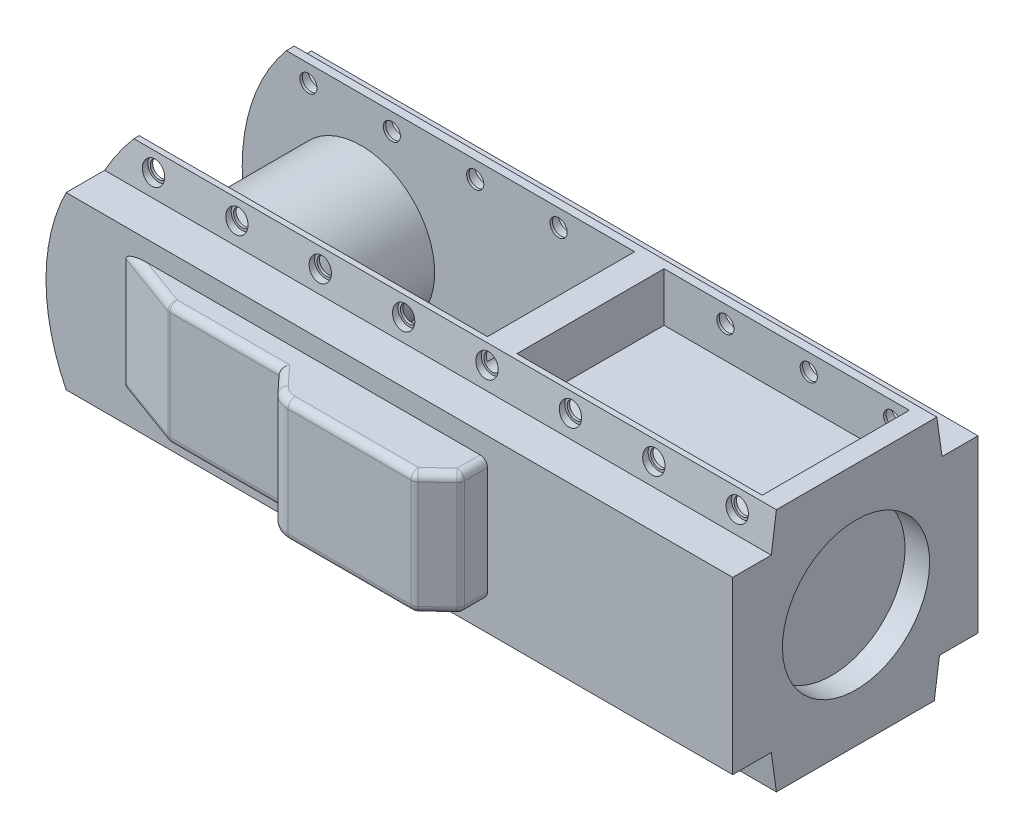
from build123d import *

# Parameters (mm, degrees)
BOSS_EXTRUDE1_DEPTH      = 50
CUT_EXTRUDE1_DEPTH       = 244.0672613377967
SKETCH4_W                = 284.0000000000001
SKETCH4_H                = 60.00000000000001
CUT_EXTRUDE2_DEPTH       = 201.298739878774
SKETCH6_W                = 15.000000000000007
SKETCH6_H                = 15
SKETCH6_W_2              = 13.951744254660802
CUT_EXTRUDE3_DEPTH       = 320.83626001686685
SKETCH7_R                = 29.999999999999996
BOSS_EXTRUDE2_DEPTH      = 30
BOSS_EXTRUDE3_DEPTH      = 10
BOSS_EXTRUDE4_DEPTH      = 20
CHAMFER1_SIZE            = 10
CHAMFER1_SIZE_2          = 9.325150861
CHAMFER2_SIZE            = 10.919107028
CHAMFER2_SIZE_2          = 30
FILLET1_R                = 3
CUT_EXTRUDE4_DEPTH       = 20
FILLET2_R                = 10
CHAMFER3_SIZE            = 20
CHAMFER3_SIZE_2          = 2.810816694
SKETCH11_R               = 3.5000000000000075
CUT_EXTRUDE5_DEPTH       = 30
SKETCH12_R               = 4.500000000000005
CUT_EXTRUDE6_DEPTH       = 19
LPATTERN1_COUNT          = 8
LPATTERN1_PITCH          = 34
MIRROR1_COPY_1_SKETCH_R  = 3.5000000000000075
MIRROR1_COPY_1_DEPTH     = 30
MIRROR1_COPY_2_SKETCH_R  = 3.5000000000000075
MIRROR1_COPY_2_DEPTH     = 30
MIRROR1_COPY_3_SKETCH_R  = 3.5000000000000075
MIRROR1_COPY_3_DEPTH     = 30
MIRROR1_COPY_4_SKETCH_R  = 3.5000000000000075
MIRROR1_COPY_4_DEPTH     = 30
MIRROR1_COPY_5_SKETCH_R  = 3.5000000000000075
MIRROR1_COPY_5_DEPTH     = 30
MIRROR1_COPY_6_SKETCH_R  = 3.5000000000000075
MIRROR1_COPY_6_DEPTH     = 30
MIRROR1_COPY_7_SKETCH_R  = 3.5000000000000075
MIRROR1_COPY_7_DEPTH     = 30
MIRROR1_COPY_8_SKETCH_R  = 4.500000000000005
MIRROR1_COPY_8_DEPTH     = 19
MIRROR1_COPY_9_SKETCH_R  = 4.500000000000005
MIRROR1_COPY_9_DEPTH     = 19
MIRROR1_COPY_10_SKETCH_R = 4.500000000000005
MIRROR1_COPY_10_DEPTH    = 19
MIRROR1_COPY_11_SKETCH_R = 4.500000000000005
MIRROR1_COPY_11_DEPTH    = 19
MIRROR1_COPY_12_SKETCH_R = 4.500000000000005
MIRROR1_COPY_12_DEPTH    = 19
MIRROR1_COPY_13_SKETCH_R = 4.500000000000005
MIRROR1_COPY_13_DEPTH    = 19
MIRROR1_COPY_14_SKETCH_R = 4.500000000000005
MIRROR1_COPY_14_DEPTH    = 19
MIRROR8_COPY_1_SKETCH_R  = 3.5000000000000075
MIRROR8_COPY_1_DEPTH     = 30
MIRROR8_COPY_2_SKETCH_R  = 3.5000000000000075
MIRROR8_COPY_2_DEPTH     = 30
MIRROR8_COPY_3_SKETCH_R  = 3.5000000000000075
MIRROR8_COPY_3_DEPTH     = 30
MIRROR8_COPY_4_SKETCH_R  = 3.5000000000000075
MIRROR8_COPY_4_DEPTH     = 30
MIRROR8_COPY_5_SKETCH_R  = 3.5000000000000075
MIRROR8_COPY_5_DEPTH     = 30
MIRROR8_COPY_6_SKETCH_R  = 3.5000000000000075
MIRROR8_COPY_6_DEPTH     = 30
MIRROR8_COPY_7_SKETCH_R  = 3.5000000000000075
MIRROR8_COPY_7_DEPTH     = 30
MIRROR8_COPY_8_SKETCH_R  = 4.500000000000005
MIRROR8_COPY_8_DEPTH     = 19
MIRROR8_COPY_9_SKETCH_R  = 4.500000000000005
MIRROR8_COPY_9_DEPTH     = 19
MIRROR8_COPY_10_SKETCH_R = 4.500000000000005
MIRROR8_COPY_10_DEPTH    = 19
MIRROR8_COPY_11_SKETCH_R = 4.500000000000005
MIRROR8_COPY_11_DEPTH    = 19
MIRROR8_COPY_12_SKETCH_R = 4.500000000000005
MIRROR8_COPY_12_DEPTH    = 19
MIRROR8_COPY_13_SKETCH_R = 4.500000000000005
MIRROR8_COPY_13_DEPTH    = 19
MIRROR8_COPY_14_SKETCH_R = 4.500000000000005
MIRROR8_COPY_14_DEPTH    = 19
MIRROR8_COPY_15_SKETCH_R = 3.5000000000000075
MIRROR8_COPY_15_DEPTH    = 30
MIRROR8_COPY_16_SKETCH_R = 4.500000000000005
MIRROR8_COPY_16_DEPTH    = 19
MIRROR8_COPY_17_SKETCH_R = 3.5000000000000075
MIRROR8_COPY_17_DEPTH    = 30
MIRROR8_COPY_18_SKETCH_R = 3.5000000000000075
MIRROR8_COPY_18_DEPTH    = 30
MIRROR8_COPY_19_SKETCH_R = 3.5000000000000075
MIRROR8_COPY_19_DEPTH    = 30
MIRROR8_COPY_20_SKETCH_R = 3.5000000000000075
MIRROR8_COPY_20_DEPTH    = 30
MIRROR8_COPY_21_SKETCH_R = 3.5000000000000075
MIRROR8_COPY_21_DEPTH    = 30
MIRROR8_COPY_22_SKETCH_R = 3.5000000000000075
MIRROR8_COPY_22_DEPTH    = 30
MIRROR8_COPY_23_SKETCH_R = 3.5000000000000075
MIRROR8_COPY_23_DEPTH    = 30
MIRROR8_COPY_24_SKETCH_R = 4.500000000000005
MIRROR8_COPY_24_DEPTH    = 19
MIRROR8_COPY_25_SKETCH_R = 4.500000000000005
MIRROR8_COPY_25_DEPTH    = 19
MIRROR8_COPY_26_SKETCH_R = 4.500000000000005
MIRROR8_COPY_26_DEPTH    = 19
MIRROR8_COPY_27_SKETCH_R = 4.500000000000005
MIRROR8_COPY_27_DEPTH    = 19
MIRROR8_COPY_28_SKETCH_R = 4.500000000000005
MIRROR8_COPY_28_DEPTH    = 19
MIRROR8_COPY_29_SKETCH_R = 4.500000000000005
MIRROR8_COPY_29_DEPTH    = 19
MIRROR8_COPY_30_SKETCH_R = 4.500000000000005
MIRROR8_COPY_30_DEPTH    = 19
SKETCH13_R               = 30
CUT_EXTRUDE7_DEPTH       = 10


with BuildPart() as part:
    # Sketch2 → Boss-Extrude1 (new, symmetric)
    with BuildSketch(Plane.XY):
        Polygon((113.60751124921575, 146.27109496266473), (-166.39248875078428, 146.2710949626647), (-166.39248875078428, 46.60603145320362), (113.60751124921576, 46.60603145320365), align=None)
    extrude(amount=BOSS_EXTRUDE1_DEPTH, both=True)

    # Sketch3 → Cut-Extrude1 (cut, through all)
    with BuildSketch(Plane.XY.offset(50)):
        with BuildLine():
            ThreePointArc((-166.39248875078425, 96.4385632079337), (-161.75456677804212, 122.93045451964585), (-148.3924887507843, 146.2710949626647))
            Line((-148.3924887507843, 146.2710949626647), (-166.39248875078428, 146.2710949626647))
            Line((-166.39248875078428, 146.2710949626647), (-166.39248875078428, 96.4385632079337))
        make_face()
        with BuildLine():
            ThreePointArc((-148.3924887507843, 46.60603145320361), (-161.75456677804198, 69.94667189622204), (-166.39248875078425, 96.4385632079337))
            Line((-166.39248875078428, 96.4385632079337), (-166.39248875078428, 46.60603145320363))
            Line((-166.39248875078428, 46.60603145320362), (-148.3924887507843, 46.60603145320362))
        make_face()
    extrude(amount=-CUT_EXTRUDE1_DEPTH, mode=Mode.SUBTRACT)

    # Sketch4 → Cut-Extrude2 (cut, through all)
    with BuildSketch(Plane(origin=(-1.45e-14, 146.27109496266473, 0), x_dir=(1, 1.3e-16, 0), z_dir=(-1.3e-16, 1, 0))):
        with Locations((-148.3924887507843, 0)):
            Rectangle(SKETCH4_W, SKETCH4_H)
    extrude(amount=-CUT_EXTRUDE2_DEPTH, mode=Mode.SUBTRACT)

    # Sketch6 → Cut-Extrude3 (cut, through all)
    with BuildSketch(Plane(origin=(113.60751124921576, 1.582e-14, 0), x_dir=(0, 0, -1), z_dir=(1, 1.4e-16, 0))):
        with Locations((-42.5, 138.7710949626647)):
            Rectangle(SKETCH6_W, SKETCH6_H)
        with Locations((43.02412787266961, 138.7710949626647)):
            Rectangle(SKETCH6_W_2, SKETCH6_H)
        with Locations((-42.5, 54.106031453203634)):
            Rectangle(SKETCH6_W, SKETCH6_H)
        with Locations((42.5, 54.106031453203634)):
            Rectangle(SKETCH6_W, SKETCH6_H)
    extrude(amount=-CUT_EXTRUDE3_DEPTH, mode=Mode.SUBTRACT)

    # Sketch7 → Boss-Extrude2 (add, symmetric)
    with BuildSketch(Plane.XY):
        with Locations(Location((-117.91264654563462, 98.03009001292648, 0), (0, 0, 180))):
            Circle(SKETCH7_R)
    extrude(amount=BOSS_EXTRUDE2_DEPTH, both=True)

    # Sketch8 → Boss-Extrude3 (add)
    with BuildSketch(Plane.XY.offset(50)):
        Polygon((-61.39248875078425, 123.0300900129265), (-136.39248875078422, 123.0300900129265), (-136.39248875078425, 73.03009001292648), (-61.39248875078425, 73.03009001292648), align=None)
        Polygon((13.607511249215747, 123.0300900129265), (-61.39248875078425, 123.0300900129265), (-61.39248875078425, 73.03009001292648), (13.607511249215747, 73.0300900129265), align=None)
    extrude(amount=BOSS_EXTRUDE3_DEPTH)

    # Sketch8<3> → Boss-Extrude4 (add)
    with BuildSketch(Plane.XY.offset(50)):
        Polygon((13.607511249215747, 123.0300900129265), (-61.39248875078425, 123.0300900129265), (-61.39248875078425, 73.03009001292648), (13.607511249215747, 73.0300900129265), align=None)
    extrude(amount=BOSS_EXTRUDE4_DEPTH)

    # Chamfer1
    # the kernel refuses this chamfer: 10, 9.325150861 mm, written as the material it takes off along each edge
    with BuildSketch(Plane(origin=(13.607511249215754, 47.289699862795544, 70), x_dir=(-0.9996489389454055, 0, 0.026495261186203833), z_dir=(-1.1e-16, 1, 0))) as chamfer1_piece_1:
        Polygon((CHAMFER1_SIZE * 0.999648938945, -CHAMFER1_SIZE * 0.0264952611862), (-CHAMFER1_SIZE_2 * 0.0264952611873, -CHAMFER1_SIZE_2 * 0.999648938986), (0, 0), align=None)
    extrude(amount=101.4807803002619, mode=Mode.SUBTRACT)
    with BuildSketch(Plane(origin=(-61.39248875078425, 148.77048016305744, 70), x_dir=(-0.026495261186203822, 0, -0.9996489389454055), z_dir=(0, -1, 0))) as chamfer1_piece_2:
        Polygon((CHAMFER1_SIZE * 0.999648938945, CHAMFER1_SIZE * 0.0264952611862), (-CHAMFER1_SIZE_2 * 0.0264952611873, CHAMFER1_SIZE_2 * 0.999648938986), (0, 0), align=None)
    extrude(amount=101.48078030026191, mode=Mode.SUBTRACT)

    # Chamfer2
    # the kernel refuses this chamfer: 30, 10.919107028 mm, written as the material it takes off along each edge
    with BuildSketch(Plane(origin=(-136.39248875078417, 200.85593198944264, 60), x_dir=(-0.09904090225204853, 0, -0.9950833631817488), z_dir=(-5.7e-16, -1, 0))) as chamfer2_piece_1_section:
        Polygon((CHAMFER2_SIZE * 0.99508336318, CHAMFER2_SIZE * 0.0990409022519), (-CHAMFER2_SIZE_2 * 0.099040902252, CHAMFER2_SIZE_2 * 0.995083363182), (0, 0), align=None)
    chamfer2_piece_1 = extrude(amount=205.65168395303226, mode=Mode.PRIVATE)
    chamfer2_piece_1 = split(chamfer2_piece_1, bisect_by=Plane(origin=(-125.96440191049959, 98.03009001292652, 50), z_dir=(0, 0, 1)), keep=Keep.TOP, mode=Mode.PRIVATE)
    add(chamfer2_piece_1, mode=Mode.SUBTRACT)

    # Fillet1
    fillet1_edges = [part.edges().sort_by_distance(p)[0] for p in [
        (13.607511249215747, 123.0300900129265, 55.337424569310656),
        (13.60751124921575, 73.0300900129265, 55.337424569310656),
        (13.607511249217987, 98.0300900129265, 60.67484913862131),
        (-24.229913320092628, 73.03009001292648, 70),
        (-56.72991332009458, 73.03009001292648, 65.00000000000203),
        (8.6075112492179, 73.03009001292648, 65.3374245693107),
        (-24.229913320092628, 123.0300900129265, 70),
        (3.607511249220053, 98.0300900129265, 69.999999999998),
        (-56.72991332009458, 123.0300900129265, 65.00000000000202),
        (8.6075112492179, 123.0300900129265, 65.3374245693107),
        (-83.89248875078044, 73.03009001292648, 60),
        (-83.89248875078044, 123.0300900129265, 60),
        (-106.39248875077664, 98.03009001292648, 60),
        (-120.12987584805919, 73.03009001292646, 55),
        (-120.12987584805919, 123.03009001292648, 55),
    ]]
    fillet(fillet1_edges, radius=FILLET1_R)

    # Sketch10 → Cut-Extrude4 (cut)
    with BuildSketch(Plane(origin=(-1.45e-14, 146.27109496266473, 0), x_dir=(1, 1e-16, 0), z_dir=(-1e-16, 1, 0))):
        Polygon((5.607511249215772, 30.000000000000004), (105.60751124921578, 30.000000000000004), (105.60751124921579, -29.999999999999996), (5.607511249215779, -30), align=None)
    extrude(amount=-CUT_EXTRUDE4_DEPTH, mode=Mode.SUBTRACT)

    # Fillet2
    # the kernel refuses this fillet: 10 mm, written as the material it takes off along each edge
    with BuildSketch(Plane(origin=(-47.719214139796605, 123.0300900129265, 60), x_dir=(-0.7313537016190976, 0, 0.6819983600625766), z_dir=(-0.6819983600625766, 0, -0.7313537016190976))) as fillet2_piece_1:
        with BuildLine():
            CenterArc((7, -3), 3, 0, 90)
            Line((10, -3), (10, 0))
            Line((10, 0), (7, 0))
        make_face()
    revolve(axis=Axis((-47.719214139796605, 123.0300900129265, 60), (0, 1, 0)), revolution_arc=46.99999999999388, mode=Mode.SUBTRACT)
    with BuildSketch(Plane(origin=(-47.719214139796605, 73.03009001292648, 60), x_dir=(0, 0, 1), z_dir=(1, 0, 0))) as fillet2_piece_2:
        with BuildLine():
            CenterArc((7, -3), 3, 0, 90)
            Line((10, -3), (10, 0))
            Line((10, 0), (7, 0))
        make_face()
    revolve(axis=Axis((-47.719214139796605, 73.03009001292648, 60), (0, -1, 0)), revolution_arc=46.99999999999388, mode=Mode.SUBTRACT)
    with BuildSketch(Plane(origin=(-52.06733788940717, 123.03009001292651, 70), x_dir=(1, 0, 0), z_dir=(0, -1, 0))) as fillet2_piece_3:
        with BuildLine():
            CenterArc((FILLET2_R * 0.434812374961, -FILLET2_R), FILLET2_R, 90, 46.99999999999392)
            Line((-FILLET2_R * 0.296541326658, -FILLET2_R * 0.318001639937), (0, 0))
            Line((0, 0), (FILLET2_R * 0.434812374961, 0))
        make_face()
    extrude(amount=50.000000000000014, mode=Mode.SUBTRACT)

    # Chamfer3
    # the kernel refuses this chamfer: 20, 2.810816694 mm, written as the material it takes off along each edge
    with BuildSketch(Plane(origin=(165.58879262769187, 146.27109496266473, 35), x_dir=(0, -0.9999856632816031, 0.005354739139527851), z_dir=(-1, -1.4e-16, 0))) as chamfer3_piece_1_section:
        Polygon((CHAMFER3_SIZE * 0.999985663282, -CHAMFER3_SIZE * 0.00535473913953), (-CHAMFER3_SIZE_2 * 0.00535473913962, -CHAMFER3_SIZE_2 * 0.999985663299), (0, 0), align=None)
    chamfer3_piece_1 = extrude(amount=365.9625627569523, mode=Mode.PRIVATE)
    chamfer3_piece_1 = split(chamfer3_piece_1, bisect_by=Plane(origin=(-17.39248875078428, 131.2710949626647, 34.19252177355839), z_dir=(-1.4e-16, 1, 0)), keep=Keep.TOP, mode=Mode.PRIVATE)
    add(chamfer3_piece_1, mode=Mode.SUBTRACT)
    with BuildSketch(Plane(origin=(165.58879262769193, 46.606031453203656, 35), x_dir=(0, 0.9999856632816031, 0.005354739139527851), z_dir=(-1, -1.4e-16, 0))) as chamfer3_piece_2_section:
        Polygon((CHAMFER3_SIZE * 0.999985663282, CHAMFER3_SIZE * 0.00535473913953), (-CHAMFER3_SIZE_2 * 0.00535473913962, CHAMFER3_SIZE_2 * 0.999985663299), (0, 0), align=None)
    chamfer3_piece_2 = extrude(amount=365.9625627569524, mode=Mode.PRIVATE)
    chamfer3_piece_2 = split(chamfer3_piece_2, bisect_by=Plane(origin=(-17.392488750784253, 61.60603145320363, 34.19252177355842), z_dir=(1.4e-16, -1, 0)), keep=Keep.TOP, mode=Mode.PRIVATE)
    add(chamfer3_piece_2, mode=Mode.SUBTRACT)
    with BuildSketch(Plane(origin=(165.58879262769193, 46.606031453203656, -35), x_dir=(0, 0.9999856632816031, -0.005354739139527851), z_dir=(-1, -1.4e-16, 0))) as chamfer3_piece_3_section:
        Polygon((CHAMFER3_SIZE * 0.999985663282, -CHAMFER3_SIZE * 0.00535473913953), (-CHAMFER3_SIZE_2 * 0.00535473913962, -CHAMFER3_SIZE_2 * 0.999985663299), (0, 0), align=None)
    chamfer3_piece_3 = extrude(amount=365.9625627569524, mode=Mode.PRIVATE)
    chamfer3_piece_3 = split(chamfer3_piece_3, bisect_by=Plane(origin=(-17.39248875078431, 61.60603145320363, -34.19252177355841), z_dir=(1.4e-16, -1, 0)), keep=Keep.TOP, mode=Mode.PRIVATE)
    add(chamfer3_piece_3, mode=Mode.SUBTRACT)
    with BuildSketch(Plane(origin=(165.58879262769187, 146.27109496266473, -36.048255745339205), x_dir=(0, 0.261660851194172, 0.9651598825854406), z_dir=(-1, -1.4e-16, 0))) as chamfer3_piece_4_section:
        Polygon((CHAMFER3_SIZE_2 * 0.965159882602, -CHAMFER3_SIZE_2 * 0.261660851199), (-CHAMFER3_SIZE * 0.261660851194, -CHAMFER3_SIZE * 0.965159882585), (0, 0), align=None)
    chamfer3_piece_4 = extrude(amount=365.9625627569523, mode=Mode.PRIVATE)
    chamfer3_piece_4 = split(chamfer3_piece_4, bisect_by=Plane(origin=(-17.392488750784253, 131.2710949626647, -35.240777518897666), z_dir=(-1.4e-16, 1, 0)), keep=Keep.TOP, mode=Mode.PRIVATE)
    add(chamfer3_piece_4, mode=Mode.SUBTRACT)

    # Sketch11 → Cut-Extrude5 (cut)
    with BuildSketch(Plane.XY.offset(50)):
        with Locations((98.60751124921575, 139.2710949626647)):
            Circle(SKETCH11_R)
    cut_extrude5 = extrude(amount=-CUT_EXTRUDE5_DEPTH, mode=Mode.SUBTRACT)

    # Sketch12 → Cut-Extrude6 (cut)
    with BuildSketch(Plane.XY.offset(50)):
        with Locations((98.60751124921575, 139.2710949626647)):
            Circle(SKETCH12_R)
    cut_extrude6 = extrude(amount=-CUT_EXTRUDE6_DEPTH, mode=Mode.SUBTRACT)

    # LPattern1: Cut-Extrude5, Cut-Extrude6 ×8
    with Locations(*[(-i * LPATTERN1_PITCH, 0, 0) for i in range(1, LPATTERN1_COUNT)]):
        add(cut_extrude5, mode=Mode.SUBTRACT)
        add(cut_extrude6, mode=Mode.SUBTRACT)

    # Mirror1: Cut-Extrude5, Cut-Extrude6 across plane
    add(cut_extrude5.mirror(Plane.ZX.offset(96.43856320793418)), mode=Mode.SUBTRACT)
    add(cut_extrude6.mirror(Plane.ZX.offset(96.43856320793418)), mode=Mode.SUBTRACT)

    # Mirror1 copy 1 sketch → Mirror1 copy 1 (cut)
    with BuildSketch(Plane(origin=(-34.00000000000003, 192.87712641586836, 50), x_dir=(1, 2.8e-16, 0), z_dir=(0, 0, 1))):
        with Locations((98.60751124921575, -139.2710949626647)):
            Circle(MIRROR1_COPY_1_SKETCH_R)
    extrude(amount=-MIRROR1_COPY_1_DEPTH, mode=Mode.SUBTRACT)

    # Mirror1 copy 2 sketch → Mirror1 copy 2 (cut)
    with BuildSketch(Plane(origin=(-68.00000000000003, 192.87712641586833, 50), x_dir=(1, 2.8e-16, 0), z_dir=(0, 0, 1))):
        with Locations((98.60751124921575, -139.2710949626647)):
            Circle(MIRROR1_COPY_2_SKETCH_R)
    extrude(amount=-MIRROR1_COPY_2_DEPTH, mode=Mode.SUBTRACT)

    # Mirror1 copy 3 sketch → Mirror1 copy 3 (cut)
    with BuildSketch(Plane(origin=(-102.00000000000003, 192.87712641586833, 50), x_dir=(1, 2.8e-16, 0), z_dir=(0, 0, 1))):
        with Locations((98.60751124921575, -139.2710949626647)):
            Circle(MIRROR1_COPY_3_SKETCH_R)
    extrude(amount=-MIRROR1_COPY_3_DEPTH, mode=Mode.SUBTRACT)

    # Mirror1 copy 4 sketch → Mirror1 copy 4 (cut)
    with BuildSketch(Plane(origin=(-136.00000000000003, 192.87712641586833, 50), x_dir=(1, 2.8e-16, 0), z_dir=(0, 0, 1))):
        with Locations((98.60751124921575, -139.2710949626647)):
            Circle(MIRROR1_COPY_4_SKETCH_R)
    extrude(amount=-MIRROR1_COPY_4_DEPTH, mode=Mode.SUBTRACT)

    # Mirror1 copy 5 sketch → Mirror1 copy 5 (cut)
    with BuildSketch(Plane(origin=(-170.00000000000003, 192.8771264158683, 50), x_dir=(1, 2.8e-16, 0), z_dir=(0, 0, 1))):
        with Locations((98.60751124921575, -139.2710949626647)):
            Circle(MIRROR1_COPY_5_SKETCH_R)
    extrude(amount=-MIRROR1_COPY_5_DEPTH, mode=Mode.SUBTRACT)

    # Mirror1 copy 6 sketch → Mirror1 copy 6 (cut)
    with BuildSketch(Plane(origin=(-204.00000000000003, 192.8771264158683, 50), x_dir=(1, 2.8e-16, 0), z_dir=(0, 0, 1))):
        with Locations((98.60751124921575, -139.2710949626647)):
            Circle(MIRROR1_COPY_6_SKETCH_R)
    extrude(amount=-MIRROR1_COPY_6_DEPTH, mode=Mode.SUBTRACT)

    # Mirror1 copy 7 sketch → Mirror1 copy 7 (cut)
    with BuildSketch(Plane(origin=(-238.00000000000003, 192.8771264158683, 50), x_dir=(1, 2.8e-16, 0), z_dir=(0, 0, 1))):
        with Locations((98.60751124921575, -139.2710949626647)):
            Circle(MIRROR1_COPY_7_SKETCH_R)
    extrude(amount=-MIRROR1_COPY_7_DEPTH, mode=Mode.SUBTRACT)

    # Mirror1 copy 8 sketch → Mirror1 copy 8 (cut)
    with BuildSketch(Plane(origin=(-34.00000000000003, 192.87712641586836, 50), x_dir=(1, 2.8e-16, 0), z_dir=(0, 0, 1))):
        with Locations((98.60751124921575, -139.2710949626647)):
            Circle(MIRROR1_COPY_8_SKETCH_R)
    extrude(amount=-MIRROR1_COPY_8_DEPTH, mode=Mode.SUBTRACT)

    # Mirror1 copy 9 sketch → Mirror1 copy 9 (cut)
    with BuildSketch(Plane(origin=(-68.00000000000003, 192.87712641586833, 50), x_dir=(1, 2.8e-16, 0), z_dir=(0, 0, 1))):
        with Locations((98.60751124921575, -139.2710949626647)):
            Circle(MIRROR1_COPY_9_SKETCH_R)
    extrude(amount=-MIRROR1_COPY_9_DEPTH, mode=Mode.SUBTRACT)

    # Mirror1 copy 10 sketch → Mirror1 copy 10 (cut)
    with BuildSketch(Plane(origin=(-102.00000000000003, 192.87712641586833, 50), x_dir=(1, 2.8e-16, 0), z_dir=(0, 0, 1))):
        with Locations((98.60751124921575, -139.2710949626647)):
            Circle(MIRROR1_COPY_10_SKETCH_R)
    extrude(amount=-MIRROR1_COPY_10_DEPTH, mode=Mode.SUBTRACT)

    # Mirror1 copy 11 sketch → Mirror1 copy 11 (cut)
    with BuildSketch(Plane(origin=(-136.00000000000003, 192.87712641586833, 50), x_dir=(1, 2.8e-16, 0), z_dir=(0, 0, 1))):
        with Locations((98.60751124921575, -139.2710949626647)):
            Circle(MIRROR1_COPY_11_SKETCH_R)
    extrude(amount=-MIRROR1_COPY_11_DEPTH, mode=Mode.SUBTRACT)

    # Mirror1 copy 12 sketch → Mirror1 copy 12 (cut)
    with BuildSketch(Plane(origin=(-170.00000000000003, 192.8771264158683, 50), x_dir=(1, 2.8e-16, 0), z_dir=(0, 0, 1))):
        with Locations((98.60751124921575, -139.2710949626647)):
            Circle(MIRROR1_COPY_12_SKETCH_R)
    extrude(amount=-MIRROR1_COPY_12_DEPTH, mode=Mode.SUBTRACT)

    # Mirror1 copy 13 sketch → Mirror1 copy 13 (cut)
    with BuildSketch(Plane(origin=(-204.00000000000003, 192.8771264158683, 50), x_dir=(1, 2.8e-16, 0), z_dir=(0, 0, 1))):
        with Locations((98.60751124921575, -139.2710949626647)):
            Circle(MIRROR1_COPY_13_SKETCH_R)
    extrude(amount=-MIRROR1_COPY_13_DEPTH, mode=Mode.SUBTRACT)

    # Mirror1 copy 14 sketch → Mirror1 copy 14 (cut)
    with BuildSketch(Plane(origin=(-238.00000000000003, 192.8771264158683, 50), x_dir=(1, 2.8e-16, 0), z_dir=(0, 0, 1))):
        with Locations((98.60751124921575, -139.2710949626647)):
            Circle(MIRROR1_COPY_14_SKETCH_R)
    extrude(amount=-MIRROR1_COPY_14_DEPTH, mode=Mode.SUBTRACT)

    # Mirror8: Cut-Extrude5, Cut-Extrude6 across plane
    add(cut_extrude5.mirror(Plane.XY), mode=Mode.SUBTRACT)
    add(cut_extrude6.mirror(Plane.XY), mode=Mode.SUBTRACT)

    # Mirror8 copy 1 sketch → Mirror8 copy 1 (cut)
    with BuildSketch(Plane(origin=(-34, 0, -50), x_dir=(1, 0, 0), z_dir=(0, 0, -1))):
        with Locations((98.60751124921575, -139.2710949626647)):
            Circle(MIRROR8_COPY_1_SKETCH_R)
    extrude(amount=-MIRROR8_COPY_1_DEPTH, mode=Mode.SUBTRACT)

    # Mirror8 copy 2 sketch → Mirror8 copy 2 (cut)
    with BuildSketch(Plane(origin=(-68, 0, -50), x_dir=(1, 0, 0), z_dir=(0, 0, -1))):
        with Locations((98.60751124921575, -139.2710949626647)):
            Circle(MIRROR8_COPY_2_SKETCH_R)
    extrude(amount=-MIRROR8_COPY_2_DEPTH, mode=Mode.SUBTRACT)

    # Mirror8 copy 3 sketch → Mirror8 copy 3 (cut)
    with BuildSketch(Plane(origin=(-102, 0, -50), x_dir=(1, 0, 0), z_dir=(0, 0, -1))):
        with Locations((98.60751124921575, -139.2710949626647)):
            Circle(MIRROR8_COPY_3_SKETCH_R)
    extrude(amount=-MIRROR8_COPY_3_DEPTH, mode=Mode.SUBTRACT)

    # Mirror8 copy 4 sketch → Mirror8 copy 4 (cut)
    with BuildSketch(Plane(origin=(-136, 0, -50), x_dir=(1, 0, 0), z_dir=(0, 0, -1))):
        with Locations((98.60751124921575, -139.2710949626647)):
            Circle(MIRROR8_COPY_4_SKETCH_R)
    extrude(amount=-MIRROR8_COPY_4_DEPTH, mode=Mode.SUBTRACT)

    # Mirror8 copy 5 sketch → Mirror8 copy 5 (cut)
    with BuildSketch(Plane(origin=(-170, 0, -50), x_dir=(1, 0, 0), z_dir=(0, 0, -1))):
        with Locations((98.60751124921575, -139.2710949626647)):
            Circle(MIRROR8_COPY_5_SKETCH_R)
    extrude(amount=-MIRROR8_COPY_5_DEPTH, mode=Mode.SUBTRACT)

    # Mirror8 copy 6 sketch → Mirror8 copy 6 (cut)
    with BuildSketch(Plane(origin=(-204, 0, -50), x_dir=(1, 0, 0), z_dir=(0, 0, -1))):
        with Locations((98.60751124921575, -139.2710949626647)):
            Circle(MIRROR8_COPY_6_SKETCH_R)
    extrude(amount=-MIRROR8_COPY_6_DEPTH, mode=Mode.SUBTRACT)

    # Mirror8 copy 7 sketch → Mirror8 copy 7 (cut)
    with BuildSketch(Plane(origin=(-238, 0, -50), x_dir=(1, 0, 0), z_dir=(0, 0, -1))):
        with Locations((98.60751124921575, -139.2710949626647)):
            Circle(MIRROR8_COPY_7_SKETCH_R)
    extrude(amount=-MIRROR8_COPY_7_DEPTH, mode=Mode.SUBTRACT)

    # Mirror8 copy 8 sketch → Mirror8 copy 8 (cut)
    with BuildSketch(Plane(origin=(-34, 0, -50), x_dir=(1, 0, 0), z_dir=(0, 0, -1))):
        with Locations((98.60751124921575, -139.2710949626647)):
            Circle(MIRROR8_COPY_8_SKETCH_R)
    extrude(amount=-MIRROR8_COPY_8_DEPTH, mode=Mode.SUBTRACT)

    # Mirror8 copy 9 sketch → Mirror8 copy 9 (cut)
    with BuildSketch(Plane(origin=(-68, 0, -50), x_dir=(1, 0, 0), z_dir=(0, 0, -1))):
        with Locations((98.60751124921575, -139.2710949626647)):
            Circle(MIRROR8_COPY_9_SKETCH_R)
    extrude(amount=-MIRROR8_COPY_9_DEPTH, mode=Mode.SUBTRACT)

    # Mirror8 copy 10 sketch → Mirror8 copy 10 (cut)
    with BuildSketch(Plane(origin=(-102, 0, -50), x_dir=(1, 0, 0), z_dir=(0, 0, -1))):
        with Locations((98.60751124921575, -139.2710949626647)):
            Circle(MIRROR8_COPY_10_SKETCH_R)
    extrude(amount=-MIRROR8_COPY_10_DEPTH, mode=Mode.SUBTRACT)

    # Mirror8 copy 11 sketch → Mirror8 copy 11 (cut)
    with BuildSketch(Plane(origin=(-136, 0, -50), x_dir=(1, 0, 0), z_dir=(0, 0, -1))):
        with Locations((98.60751124921575, -139.2710949626647)):
            Circle(MIRROR8_COPY_11_SKETCH_R)
    extrude(amount=-MIRROR8_COPY_11_DEPTH, mode=Mode.SUBTRACT)

    # Mirror8 copy 12 sketch → Mirror8 copy 12 (cut)
    with BuildSketch(Plane(origin=(-170, 0, -50), x_dir=(1, 0, 0), z_dir=(0, 0, -1))):
        with Locations((98.60751124921575, -139.2710949626647)):
            Circle(MIRROR8_COPY_12_SKETCH_R)
    extrude(amount=-MIRROR8_COPY_12_DEPTH, mode=Mode.SUBTRACT)

    # Mirror8 copy 13 sketch → Mirror8 copy 13 (cut)
    with BuildSketch(Plane(origin=(-204, 0, -50), x_dir=(1, 0, 0), z_dir=(0, 0, -1))):
        with Locations((98.60751124921575, -139.2710949626647)):
            Circle(MIRROR8_COPY_13_SKETCH_R)
    extrude(amount=-MIRROR8_COPY_13_DEPTH, mode=Mode.SUBTRACT)

    # Mirror8 copy 14 sketch → Mirror8 copy 14 (cut)
    with BuildSketch(Plane(origin=(-238, 0, -50), x_dir=(1, 0, 0), z_dir=(0, 0, -1))):
        with Locations((98.60751124921575, -139.2710949626647)):
            Circle(MIRROR8_COPY_14_SKETCH_R)
    extrude(amount=-MIRROR8_COPY_14_DEPTH, mode=Mode.SUBTRACT)

    # Mirror8 copy 15 sketch → Mirror8 copy 15 (cut)
    with BuildSketch(Plane(origin=(-2.686e-14, 192.87712641586836, -50), x_dir=(1, 2.8e-16, 0), z_dir=(0, 0, -1))):
        with Locations((98.60751124921575, 139.2710949626647)):
            Circle(MIRROR8_COPY_15_SKETCH_R)
    extrude(amount=-MIRROR8_COPY_15_DEPTH, mode=Mode.SUBTRACT)

    # Mirror8 copy 16 sketch → Mirror8 copy 16 (cut)
    with BuildSketch(Plane(origin=(-2.686e-14, 192.87712641586836, -50), x_dir=(1, 2.8e-16, 0), z_dir=(0, 0, -1))):
        with Locations((98.60751124921575, 139.2710949626647)):
            Circle(MIRROR8_COPY_16_SKETCH_R)
    extrude(amount=-MIRROR8_COPY_16_DEPTH, mode=Mode.SUBTRACT)

    # Mirror8 copy 17 sketch → Mirror8 copy 17 (cut)
    with BuildSketch(Plane(origin=(-34.00000000000003, 192.87712641586836, -50), x_dir=(1, 2.8e-16, 0), z_dir=(0, 0, -1))):
        with Locations((98.60751124921575, 139.2710949626647)):
            Circle(MIRROR8_COPY_17_SKETCH_R)
    extrude(amount=-MIRROR8_COPY_17_DEPTH, mode=Mode.SUBTRACT)

    # Mirror8 copy 18 sketch → Mirror8 copy 18 (cut)
    with BuildSketch(Plane(origin=(-68.00000000000003, 192.87712641586833, -50), x_dir=(1, 2.8e-16, 0), z_dir=(0, 0, -1))):
        with Locations((98.60751124921575, 139.2710949626647)):
            Circle(MIRROR8_COPY_18_SKETCH_R)
    extrude(amount=-MIRROR8_COPY_18_DEPTH, mode=Mode.SUBTRACT)

    # Mirror8 copy 19 sketch → Mirror8 copy 19 (cut)
    with BuildSketch(Plane(origin=(-102.00000000000003, 192.87712641586833, -50), x_dir=(1, 2.8e-16, 0), z_dir=(0, 0, -1))):
        with Locations((98.60751124921575, 139.2710949626647)):
            Circle(MIRROR8_COPY_19_SKETCH_R)
    extrude(amount=-MIRROR8_COPY_19_DEPTH, mode=Mode.SUBTRACT)

    # Mirror8 copy 20 sketch → Mirror8 copy 20 (cut)
    with BuildSketch(Plane(origin=(-136.00000000000003, 192.87712641586833, -50), x_dir=(1, 2.8e-16, 0), z_dir=(0, 0, -1))):
        with Locations((98.60751124921575, 139.2710949626647)):
            Circle(MIRROR8_COPY_20_SKETCH_R)
    extrude(amount=-MIRROR8_COPY_20_DEPTH, mode=Mode.SUBTRACT)

    # Mirror8 copy 21 sketch → Mirror8 copy 21 (cut)
    with BuildSketch(Plane(origin=(-170.00000000000003, 192.8771264158683, -50), x_dir=(1, 2.8e-16, 0), z_dir=(0, 0, -1))):
        with Locations((98.60751124921575, 139.2710949626647)):
            Circle(MIRROR8_COPY_21_SKETCH_R)
    extrude(amount=-MIRROR8_COPY_21_DEPTH, mode=Mode.SUBTRACT)

    # Mirror8 copy 22 sketch → Mirror8 copy 22 (cut)
    with BuildSketch(Plane(origin=(-204.00000000000003, 192.8771264158683, -50), x_dir=(1, 2.8e-16, 0), z_dir=(0, 0, -1))):
        with Locations((98.60751124921575, 139.2710949626647)):
            Circle(MIRROR8_COPY_22_SKETCH_R)
    extrude(amount=-MIRROR8_COPY_22_DEPTH, mode=Mode.SUBTRACT)

    # Mirror8 copy 23 sketch → Mirror8 copy 23 (cut)
    with BuildSketch(Plane(origin=(-238.00000000000003, 192.8771264158683, -50), x_dir=(1, 2.8e-16, 0), z_dir=(0, 0, -1))):
        with Locations((98.60751124921575, 139.2710949626647)):
            Circle(MIRROR8_COPY_23_SKETCH_R)
    extrude(amount=-MIRROR8_COPY_23_DEPTH, mode=Mode.SUBTRACT)

    # Mirror8 copy 24 sketch → Mirror8 copy 24 (cut)
    with BuildSketch(Plane(origin=(-34.00000000000003, 192.87712641586836, -50), x_dir=(1, 2.8e-16, 0), z_dir=(0, 0, -1))):
        with Locations((98.60751124921575, 139.2710949626647)):
            Circle(MIRROR8_COPY_24_SKETCH_R)
    extrude(amount=-MIRROR8_COPY_24_DEPTH, mode=Mode.SUBTRACT)

    # Mirror8 copy 25 sketch → Mirror8 copy 25 (cut)
    with BuildSketch(Plane(origin=(-68.00000000000003, 192.87712641586833, -50), x_dir=(1, 2.8e-16, 0), z_dir=(0, 0, -1))):
        with Locations((98.60751124921575, 139.2710949626647)):
            Circle(MIRROR8_COPY_25_SKETCH_R)
    extrude(amount=-MIRROR8_COPY_25_DEPTH, mode=Mode.SUBTRACT)

    # Mirror8 copy 26 sketch → Mirror8 copy 26 (cut)
    with BuildSketch(Plane(origin=(-102.00000000000003, 192.87712641586833, -50), x_dir=(1, 2.8e-16, 0), z_dir=(0, 0, -1))):
        with Locations((98.60751124921575, 139.2710949626647)):
            Circle(MIRROR8_COPY_26_SKETCH_R)
    extrude(amount=-MIRROR8_COPY_26_DEPTH, mode=Mode.SUBTRACT)

    # Mirror8 copy 27 sketch → Mirror8 copy 27 (cut)
    with BuildSketch(Plane(origin=(-136.00000000000003, 192.87712641586833, -50), x_dir=(1, 2.8e-16, 0), z_dir=(0, 0, -1))):
        with Locations((98.60751124921575, 139.2710949626647)):
            Circle(MIRROR8_COPY_27_SKETCH_R)
    extrude(amount=-MIRROR8_COPY_27_DEPTH, mode=Mode.SUBTRACT)

    # Mirror8 copy 28 sketch → Mirror8 copy 28 (cut)
    with BuildSketch(Plane(origin=(-170.00000000000003, 192.8771264158683, -50), x_dir=(1, 2.8e-16, 0), z_dir=(0, 0, -1))):
        with Locations((98.60751124921575, 139.2710949626647)):
            Circle(MIRROR8_COPY_28_SKETCH_R)
    extrude(amount=-MIRROR8_COPY_28_DEPTH, mode=Mode.SUBTRACT)

    # Mirror8 copy 29 sketch → Mirror8 copy 29 (cut)
    with BuildSketch(Plane(origin=(-204.00000000000003, 192.8771264158683, -50), x_dir=(1, 2.8e-16, 0), z_dir=(0, 0, -1))):
        with Locations((98.60751124921575, 139.2710949626647)):
            Circle(MIRROR8_COPY_29_SKETCH_R)
    extrude(amount=-MIRROR8_COPY_29_DEPTH, mode=Mode.SUBTRACT)

    # Mirror8 copy 30 sketch → Mirror8 copy 30 (cut)
    with BuildSketch(Plane(origin=(-238.00000000000003, 192.8771264158683, -50), x_dir=(1, 2.8e-16, 0), z_dir=(0, 0, -1))):
        with Locations((98.60751124921575, 139.2710949626647)):
            Circle(MIRROR8_COPY_30_SKETCH_R)
    extrude(amount=-MIRROR8_COPY_30_DEPTH, mode=Mode.SUBTRACT)

    # Sketch13 → Cut-Extrude7 (cut)
    with BuildSketch(Plane(origin=(113.60751124921576, 1.582e-14, 0), x_dir=(0, 0, -1), z_dir=(1, 1.4e-16, 0))):
        with Locations(Location((0.2620639363348012, 96.43856320793418, 0), (0, 0, 90))):
            Circle(SKETCH13_R)
    extrude(amount=-CUT_EXTRUDE7_DEPTH, mode=Mode.SUBTRACT)


solid = part.part
